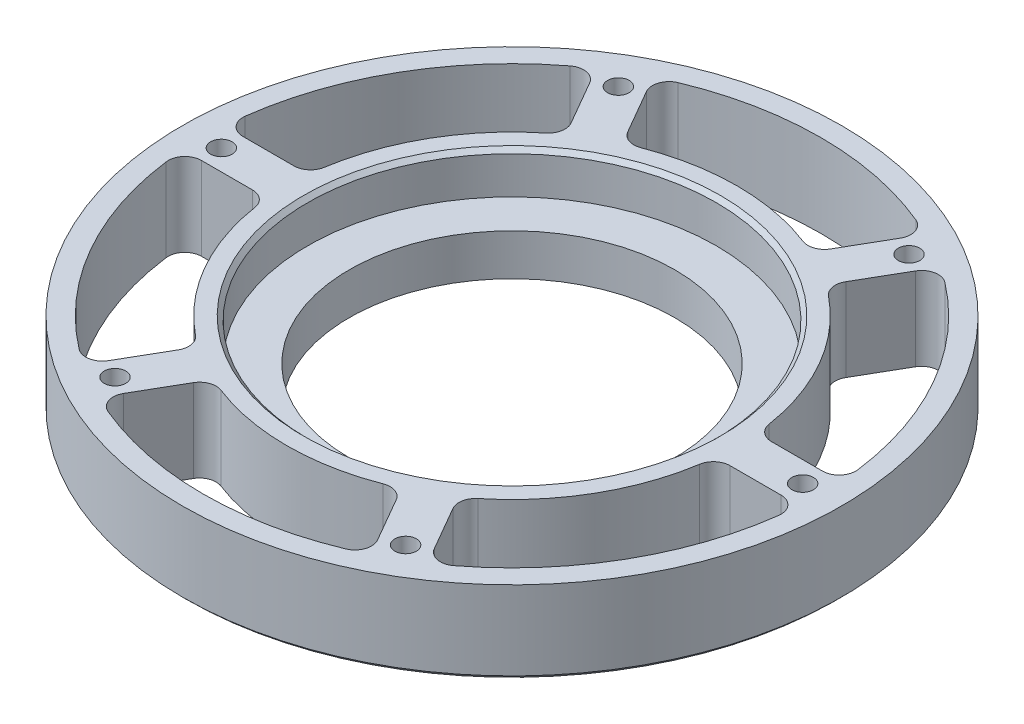
from build123d import *

# Parameters (mm, degrees)
F_6_0_204_DIAMETER_HOLE1_D = 5.1816
CIRPATTERN3_COUNT          = 6
CUT_EXTRUDE1_DEPTH         = 115.02096846633079
FILLET1_R                  = 4
CIRPATTERN4_COUNT          = 6
FILLET1_OF_CIRPATTERN4_R   = 4
CHAMFER1_SIZE              = 1
CHAMFER2_SIZE              = 1


with BuildPart() as part:
    # Sketch2 → Revolve1 (revolve)
    with BuildSketch(Plane(origin=(0, 0, 0), x_dir=(0, 0, -1), z_dir=(1, 0, 0))):
        Polygon((-39.2125, -8.7e-16), (-79.375, -4.92e-15), (-79.375, 19.999999999999996), (-49.2125, 19.999999999999993), (-49.21250000000001, 9.999999999999993), (-39.21250000000001, 9.999999999999991), align=None)
    revolve(axis=Axis((0, -1.0000000000000027, 0), (0, 1, 0)))

    # #6 (0.204) Diameter Hole1 (through all)
    with Locations(Plane(origin=(0, 19.999999999999996, 0), x_dir=(1, 0, 0), z_dir=(0, 1, 0))):
        with Locations((-35, 60.621778265)):
            f_6_0_204_diameter_hole1 = Hole(F_6_0_204_DIAMETER_HOLE1_D / 2)

    # CirPattern3: #6 (0.204) Diameter Hole1 ×6 about axis
    cirpattern3_axis = Axis((0, -1.0000000000000027, 0), (0, 1, 0))
    for i in range(1, CIRPATTERN3_COUNT):
        add(f_6_0_204_diameter_hole1.rotate(cirpattern3_axis, i * 360 / CIRPATTERN3_COUNT), mode=Mode.SUBTRACT)

    # Sketch8 → Cut-Extrude1 (cut, through all)
    with BuildSketch(Plane(origin=(0, 19.999999999999996, 0), x_dir=(1, 0, 0), z_dir=(0, 1, 0))):
        with BuildLine():
            Line((-32.773244205941005, 66.76492409355194), (-22.660589701137393, 49.249292691841845))
            ThreePointArc((-22.660589701137393, 49.249292691841845), (3.32e-15, 54.212500000000006), (22.660589701137393, 49.249292691841845))
            Line((22.660589701137393, 49.249292691841845), (32.773244205941005, 66.76492409355194))
            ThreePointArc((32.773244205941005, 66.76492409355194), (4.55e-15, 74.37499999999999), (-32.773244205941005, 66.76492409355194))
        make_face()
    cut_extrude1 = extrude(amount=-CUT_EXTRUDE1_DEPTH, mode=Mode.SUBTRACT)

    # Fillet1
    fillet1_edges = [part.edges().sort_by_distance(p)[0] for p in [
        (32.773244205941005, 9.999999999999998, -66.76492409355194),
        (22.660589701137397, 9.999999999999998, -49.249292691841845),
        (-32.77324420594101, 9.999999999999998, -66.76492409355194),
        (-22.660589701137393, 9.999999999999998, -49.249292691841845),
    ]]
    fillet(fillet1_edges, radius=FILLET1_R)

    # CirPattern4: Cut-Extrude1 ×6 about axis
    cirpattern4_axis = Axis((0, -1.0000000000000027, 0), (0, 1, 0))
    for i in range(1, CIRPATTERN4_COUNT):
        add(cut_extrude1.rotate(cirpattern4_axis, i * 360 / CIRPATTERN4_COUNT), mode=Mode.SUBTRACT)

    # Fillet1 of CirPattern4
    fillet1_of_cirpattern4_edges = [part.edges().sort_by_distance(p)[0] for p in [
        (-41.43349824378521, 9.999999999999998, -61.76492409355205),
        (-31.320843738981637, 9.999999999999998, -44.24929269184193),
        (-74.20674244972622, 9.999999999999998, -4.9999999999999005),
        (-53.981433440119034, 9.999999999999998, -4.999999999999929),
        (-74.20674244972622, 9.999999999999998, 4.999999999999879),
        (-53.981433440119034, 9.999999999999998, 4.999999999999904),
        (-41.43349824378522, 9.999999999999998, 61.76492409355204),
        (-31.32084373898165, 9.999999999999998, 44.249292691841916),
        (-32.77324420594101, 9.999999999999998, 66.76492409355194),
        (-22.660589701137404, 9.999999999999998, 49.249292691841845),
        (32.773244205941005, 9.999999999999998, 66.76492409355194),
        (22.660589701137386, 9.999999999999998, 49.249292691841845),
        (41.43349824378518, 9.999999999999998, 61.76492409355206),
        (31.320843738981612, 9.999999999999998, 44.249292691841944),
        (74.20674244972622, 9.999999999999998, 4.999999999999929),
        (53.98143344011903, 9.999999999999998, 4.999999999999947),
        (74.20674244972622, 9.999999999999998, -4.999999999999908),
        (53.981433440119034, 9.999999999999998, -4.999999999999925),
        (41.43349824378521, 9.999999999999998, -61.764924093552054),
        (31.320843738981637, 9.999999999999998, -44.24929269184193),
    ]]
    fillet(fillet1_of_cirpattern4_edges, radius=FILLET1_OF_CIRPATTERN4_R)

    # Chamfer1
    chamfer1_edges = [part.edges().sort_by_distance(p)[0] for p in [
        (6.03e-15, 19.999999999999993, -49.2125),
    ]]
    chamfer(chamfer1_edges, length=CHAMFER1_SIZE)

    # Chamfer2
    chamfer2_edges = [part.edges().sort_by_distance(p)[0] for p in [
        (9.72e-15, -4.88e-15, -79.375),
    ]]
    chamfer(chamfer2_edges, length=CHAMFER2_SIZE)


solid = part.part
